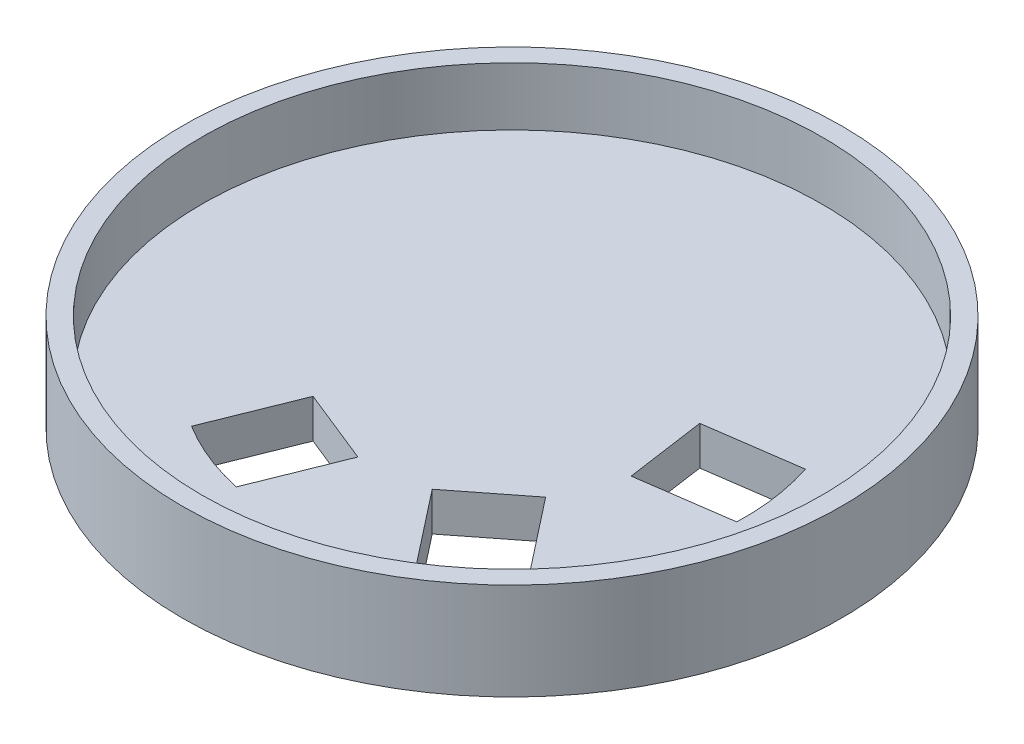
from build123d import *

# Parameters (mm, degrees)
SKETCH1_R           = 17
BOSS_EXTRUDE1_DEPTH = 5
SKETCH2_R           = 16
CUT_EXTRUDE1_DEPTH  = 3
CUT_EXTRUDE3_DEPTH  = 3


with BuildPart() as part:
    # Sketch1 → Boss-Extrude1 (new body)
    with BuildSketch(Plane(origin=(0, 0, 0), x_dir=(1, 0, 0), z_dir=(0, 1, 0))):
        Circle(SKETCH1_R)
    extrude(amount=BOSS_EXTRUDE1_DEPTH)

    # Sketch2 → Cut-Extrude1 (cut)
    with BuildSketch(Plane(origin=(0, 5, 0), x_dir=(1, 0, 0), z_dir=(0, 1, 0))):
        Circle(SKETCH2_R)
    extrude(amount=-CUT_EXTRUDE1_DEPTH, mode=Mode.SUBTRACT)

    # Sketch3 → Cut-Extrude3 (cut)
    with BuildSketch(Plane.XZ):
        with BuildLine():
            Line((-6.342587058, 10.186834121), (-4.545064142, 5.717037978))
            Line((-4.545064142, 5.717037978), (-0.678456873, 7.271989245))
            Line((-0.678456873, 7.271989245), (-2.475979789, 11.741785387))
            ThreePointArc((-2.475979789, 11.741785387), (-4.477303728, 11.133451905), (-6.342587058, 10.186834121))
        make_face()
        with BuildLine():
            Line((5.650763604, 10.586258579), (2.678568053, 6.794659998))
            Line((2.678568053, 6.794659998), (5.958498985, 4.22355551))
            Line((5.958498985, 4.22355551), (8.930694537, 8.01515409))
            ThreePointArc((8.930694537, 8.01515409), (7.403200318, 9.444184721), (5.650763604, 10.586258579))
        make_face()
        with BuildLine():
            Line((11.993350662, 0.399424457), (7.223632195, 1.07762202))
            Line((7.223632195, 1.07762202), (6.636955859, -3.048433735))
            Line((6.636955859, -3.048433735), (11.406674326, -3.726631297))
            ThreePointArc((11.406674326, -3.726631297), (11.880504046, -1.689267184), (11.993350662, 0.399424457))
        make_face()
    extrude(amount=-CUT_EXTRUDE3_DEPTH, mode=Mode.SUBTRACT)


solid = part.part
